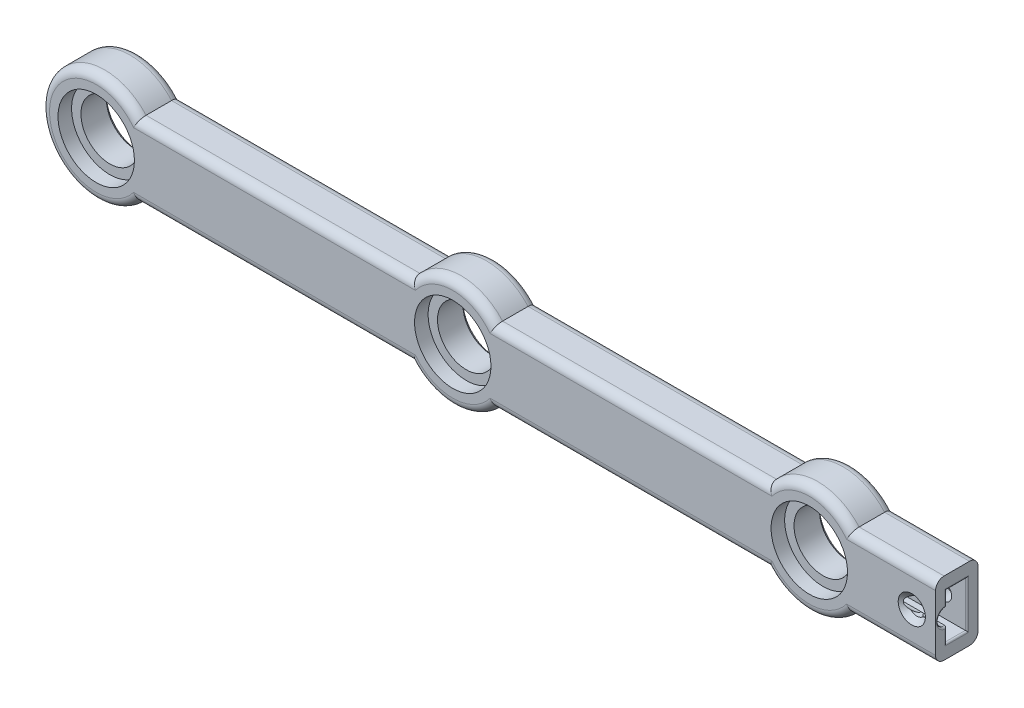
from build123d import *

# Parameters (mm, degrees)
SKETCH1_R           = 1.7
BOSS_EXTRUDE1_DEPTH = 2.5
SKETCH2_R           = 2.25
CUT_EXTRUDE1_DEPTH  = 0.8
CHAMFER1_SIZE       = 0.2
FILLET1_R           = 0.5
CUT_EXTRUDE2_DEPTH  = 4
FILLET2_R           = 0.1
SKETCH4_R           = 0.5
CUT_EXTRUDE3_DEPTH  = 29.731298369
CHAMFER2_SIZE       = 0.3


with BuildPart() as part:
    # Sketch1 → Boss-Extrude1 (new body)
    with BuildSketch(Plane.XY):
        with BuildLine():
            Line((-18.562788479, 2.15), (-2.437211521, 2.15))
            ThreePointArc((-2.437211521, 2.15), (0, 3.25), (2.437211521, 2.15))
            Line((2.437211521, 2.15), (18.562788479, 2.15))
            ThreePointArc((18.562788479, 2.15), (21, 3.25), (23.437211521, 2.15))
            Line((23.437211521, 2.15), (28.437211521, 2.15))
            Line((28.437211521, 2.15), (28.437211521, -2.15))
            Line((28.437211521, -2.15), (23.437211521, -2.15))
            ThreePointArc((23.437211521, -2.15), (21, -3.25), (18.562788479, -2.15))
            Line((18.562788479, -2.15), (2.437211521, -2.15))
            ThreePointArc((2.437211521, -2.15), (0, -3.25), (-2.437211521, -2.15))
            Line((-2.437211521, -2.15), (-18.562788479, -2.15))
            ThreePointArc((-18.562788479, -2.15), (-24.25, 0), (-18.562788479, 2.15))
        make_face()
        Circle(SKETCH1_R, mode=Mode.SUBTRACT)
        with Locations((-21, 0)):
            Circle(SKETCH1_R, mode=Mode.SUBTRACT)
        with Locations((21, 0)):
            Circle(SKETCH1_R, mode=Mode.SUBTRACT)
    extrude(amount=BOSS_EXTRUDE1_DEPTH)

    # Sketch2 → Cut-Extrude1 (cut)
    with BuildSketch(Plane.XY.offset(2.5)):
        with Locations((-21, 0)):
            Circle(SKETCH2_R)
        Circle(SKETCH2_R)
        with Locations((21, 0)):
            Circle(SKETCH2_R)
    extrude(amount=-CUT_EXTRUDE1_DEPTH, mode=Mode.SUBTRACT)

    # Chamfer1
    chamfer1_edges = [part.edges().sort_by_distance(p)[0] for p in [
        (-1.7, 0, 0),
        (-22.7, 0, 0),
        (19.3, 0, 0),
    ]]
    chamfer(chamfer1_edges, length=CHAMFER1_SIZE)

    # Fillet1
    fillet1_edges = [part.edges().sort_by_distance(p)[0] for p in [
        (0, 3.25, 2.5),
        (25.937211521, 2.15, 0),
        (25.937211521, -2.15, 0),
        (21, -3.25, 0),
        (10.5, -2.15, 0),
        (0, -3.25, 0),
        (-10.5, 2.15, 2.5),
        (-10.5, -2.15, 0),
        (-24.25, 0, 0),
        (-10.5, 2.15, 0),
        (0, 3.25, 0),
        (10.5, 2.15, 0),
        (21, 3.25, 0),
        (-24.25, 0, 2.5),
        (-10.5, -2.15, 2.5),
        (0, -3.25, 2.5),
        (10.5, -2.15, 2.5),
        (21, -3.25, 2.5),
        (25.937211521, -2.15, 2.5),
        (25.937211521, 2.15, 2.5),
        (21, 3.25, 2.5),
        (10.5, 2.15, 2.5),
    ]]
    fillet(fillet1_edges, radius=FILLET1_R)

    # Sketch3 → Cut-Extrude2 (cut)
    with BuildSketch(Plane(origin=(28.437211521, 0, 0), x_dir=(0, 0, -1), z_dir=(1, 0, 0))):
        with BuildLine():
            Line((-1.85, -0.5), (-1.85, -1.35))
            Line((-1.85, -1.35), (-0.65, -1.35))
            Line((-0.65, -1.35), (-0.65, 1.35))
            Line((-0.65, 1.35), (-1.85, 1.35))
            Line((-1.85, 1.35), (-1.85, 0.5))
            ThreePointArc((-1.85, 0.5), (-2.35, 0), (-1.85, -0.5))
        make_face()
    extrude(amount=-CUT_EXTRUDE2_DEPTH, mode=Mode.SUBTRACT)

    # Fillet2
    fillet2_edges = [part.edges().sort_by_distance(p)[0] for p in [
        (28.437211521, 0, 0.65),
        (28.437211521, 1.35, 1.25),
        (28.437211521, 0.925, 1.85),
        (28.437211521, 0, 2.35),
        (28.437211521, -0.925, 1.85),
        (28.437211521, -1.35, 1.25),
    ]]
    fillet(fillet2_edges, radius=FILLET2_R)

    # Sketch4 → Cut-Extrude3 (cut, through all)
    with BuildSketch(Plane.XY.offset(2.5)):
        with Locations((27.037211521, 0)):
            Circle(SKETCH4_R)
    extrude(amount=-CUT_EXTRUDE3_DEPTH, mode=Mode.SUBTRACT)

    # Chamfer2
    # the kernel refuses this chamfer: 0.3 mm, written as the material it takes off along each edge
    with BuildSketch(Plane(origin=(27.037211521, 0, 2.5), x_dir=(1, 0, 0), z_dir=(0, -1, 0))) as chamfer2_piece_1:
        Polygon((0.5 + CHAMFER2_SIZE, 0), (0.5, -CHAMFER2_SIZE), (0.5, 0), align=None)
    revolve(axis=Axis((27.037211521, 0, 2.5), (0, 0, 1)), mode=Mode.SUBTRACT)


solid = part.part
